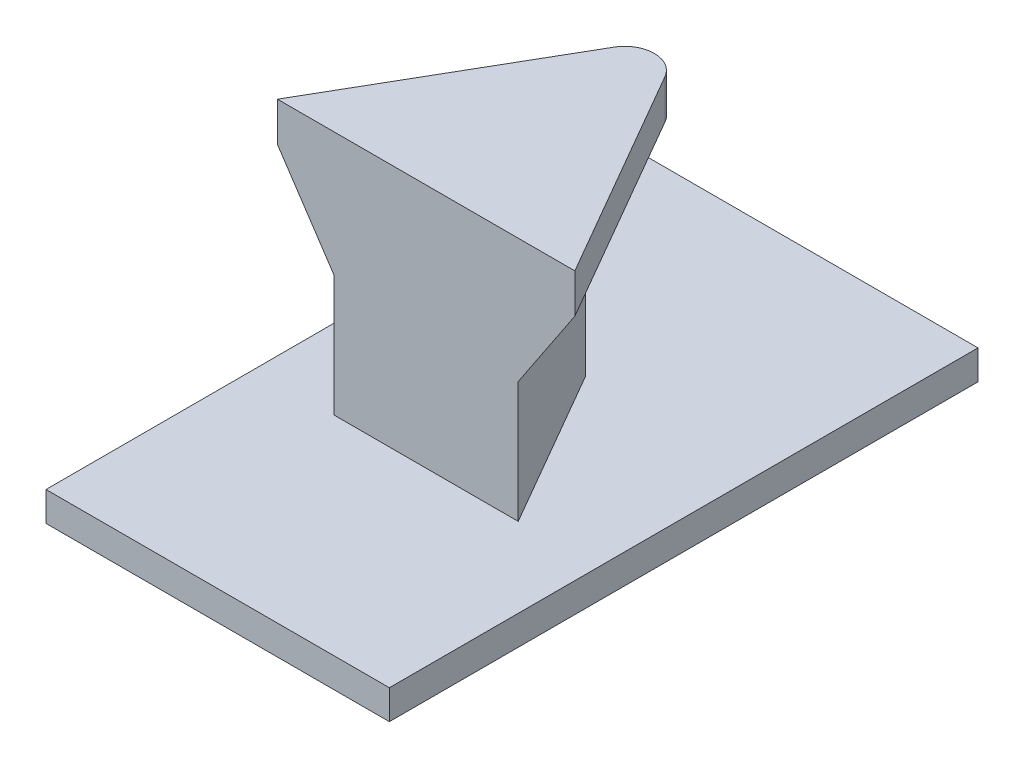
from build123d import *

# Parameters (mm, degrees)
SKETCH1_W           = 35
SKETCH1_H           = 60
BOSS_EXTRUDE1_DEPTH = 3
BOSS_EXTRUDE2_DEPTH = 25
CUT_EXTRUDE1_DEPTH  = 1
CHAMFER1_SIZE       = 11.547005384
CHAMFER1_SIZE_2     = 20


with BuildPart() as part:
    # Sketch1 → Boss-Extrude1 (new body)
    with BuildSketch(Plane(origin=(0, 0, 0), x_dir=(1, 0, 0), z_dir=(0, 1, 0))):
        Rectangle(SKETCH1_W, SKETCH1_H)
    extrude(amount=BOSS_EXTRUDE1_DEPTH)

    # Sketch2 → Boss-Extrude2 (add)
    with BuildSketch(Plane(origin=(0, 3, 0), x_dir=(1, 0, 0), z_dir=(0, 1, 0))):
        with BuildLine():
            Line((-2.598076211, 13), (-15.155444566, -8.75))
            Line((-15.155444566, -8.75), (15.155444566, -8.75))
            Line((15.155444566, -8.75), (2.598076211, 13))
            ThreePointArc((2.598076211, 13), (0, 14.5), (-2.598076211, 13))
        make_face()
    extrude(amount=BOSS_EXTRUDE2_DEPTH)

    # Sketch3 → Cut-Extrude1 (cut)
    with BuildSketch(Plane(origin=(0, 3, 0), x_dir=(1, 0, 0), z_dir=(0, 1, 0))):
        with BuildLine():
            Line((-6.495190528, -3.75), (0, 7.5))
            Line((0, 7.5), (6.495190528, -3.75))
            Line((6.495190528, -3.75), (9.381941874, -8.75))
            Line((9.381941874, -8.75), (15.155444566, -8.75))
            Line((15.155444566, -8.75), (2.598076211, 13))
            ThreePointArc((2.598076211, 13), (0, 14.5), (-2.598076211, 13))
            Line((-2.598076211, 13), (-15.155444566, -8.75))
            Line((-15.155444566, -8.75), (-9.381941874, -8.75))
            Line((-9.381941874, -8.75), (-6.495190528, -3.75))
        make_face()
    extrude(amount=CUT_EXTRUDE1_DEPTH, mode=Mode.SUBTRACT)

    # Chamfer1
    # the kernel refuses this chamfer: 20, 11.547005384 mm, written as the material it takes off along each edge
    with BuildSketch(Plane(origin=(41.026302113, 4, 53.559639706), x_dir=(-0.8645728572665647, -0.057893862402670825, 0.4991613718769001), z_dir=(-0.5000000000000038, 0, -0.8660254037844365))) as chamfer1_piece_1_section:
        Polygon((CHAMFER1_SIZE * 0.998322743736, CHAMFER1_SIZE * 0.0578938624016), (-CHAMFER1_SIZE_2 * 0.0578938624027, CHAMFER1_SIZE_2 * 0.998322743754), (0, 0), align=None)
    chamfer1_piece_1 = extrude(amount=128.598166896, mode=Mode.PRIVATE)
    chamfer1_piece_1 = split(chamfer1_piece_1, bisect_by=Plane(origin=(4.860727158, 12.114805615, 0.9190264), z_dir=(0.8660254037844364, 0, -0.500000000000004)), keep=Keep.TOP, mode=Mode.PRIVATE)
    add(chamfer1_piece_1, mode=Mode.SUBTRACT)
    with BuildSketch(Plane(origin=(41.026302113, 4, 53.559639706), x_dir=(-0.8645728572665647, -0.057893862402670825, 0.4991613718769001), z_dir=(-0.5000000000000038, 0, -0.8660254037844365))) as chamfer1_piece_2_section:
        Polygon((CHAMFER1_SIZE * 0.998322743736, CHAMFER1_SIZE * 0.0578938624016), (-CHAMFER1_SIZE_2 * 0.0578938624027, CHAMFER1_SIZE_2 * 0.998322743754), (0, 0), align=None)
    chamfer1_piece_2 = extrude(amount=128.598166896, mode=Mode.PRIVATE)
    chamfer1_piece_2 = split(chamfer1_piece_2, bisect_by=Plane(origin=(-0.762291107, 7.498768365, -6.179673073), z_dir=(-0.8660254037844386, 0, -0.5000000000000001)), keep=Keep.TOP, mode=Mode.PRIVATE)
    add(chamfer1_piece_2, mode=Mode.SUBTRACT)
    with BuildSketch(Plane(origin=(23.272781335, 4, -57.809639706), x_dir=(0.864572857266568, -0.05789386240267081, 0.49916137187689447), z_dir=(-0.49999999999999817, 0, 0.8660254037844398))) as chamfer1_piece_3_section:
        Polygon((CHAMFER1_SIZE * 0.998322743736, CHAMFER1_SIZE * 0.0578938624016), (-CHAMFER1_SIZE_2 * 0.0578938624027, CHAMFER1_SIZE_2 * 0.998322743754), (0, 0), align=None)
    chamfer1_piece_3 = extrude(amount=128.598166896, mode=Mode.PRIVATE)
    chamfer1_piece_3 = split(chamfer1_piece_3, bisect_by=Plane(origin=(0.762291107, 7.498768365, -6.179673073), z_dir=(0.8660254037844364, 0, -0.500000000000004)), keep=Keep.TOP, mode=Mode.PRIVATE)
    add(chamfer1_piece_3, mode=Mode.SUBTRACT)
    with BuildSketch(Plane(origin=(23.272781335, 4, -57.809639706), x_dir=(0.864572857266568, -0.05789386240267081, 0.49916137187689447), z_dir=(-0.49999999999999817, 0, 0.8660254037844398))) as chamfer1_piece_4_section:
        Polygon((CHAMFER1_SIZE * 0.998322743736, CHAMFER1_SIZE * 0.0578938624016), (-CHAMFER1_SIZE_2 * 0.0578938624027, CHAMFER1_SIZE_2 * 0.998322743754), (0, 0), align=None)
    chamfer1_piece_4 = extrude(amount=128.598166896, mode=Mode.PRIVATE)
    chamfer1_piece_4 = split(chamfer1_piece_4, bisect_by=Plane(origin=(-4.860727158, 12.114805615, 0.9190264), z_dir=(-0.8660254037844386, 0, -0.5000000000000001)), keep=Keep.TOP, mode=Mode.PRIVATE)
    add(chamfer1_piece_4, mode=Mode.SUBTRACT)


solid = part.part
